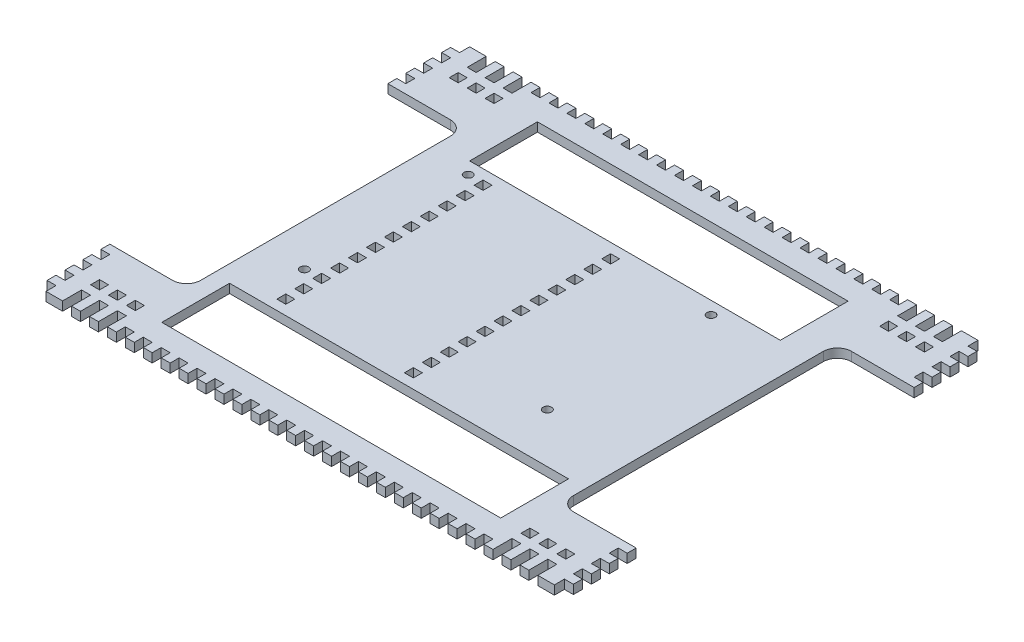
from build123d import *

# Parameters (mm, degrees)
SKETCH1_W                                  = 180
SKETCH1_H                                  = 150
BOSS_EXTRUDE1_DEPTH                        = 3.175
SKETCH3_R                                  = 1.375
CUT_EXTRUDE1_DEPTH                         = 10
SKETCH4_W                                  = 6.35
SKETCH4_H                                  = 3.175
BOSS_EXTRUDE2_DEPTH                        = 3.175
LPATTERN1_COUNT                            = 12
LPATTERN1_PITCH                            = 6.35
LPATTERN1_COL_COUNT                        = 12
LPATTERN1_COL_PITCH                        = 6.35
MIRROR1_COPY_1_SKETCH_W                    = 6.35
MIRROR1_COPY_1_SKETCH_H                    = 3.175
MIRROR1_COPY_1_DEPTH                       = 3.175
MIRROR1_COPY_2_SKETCH_W                    = 6.35
MIRROR1_COPY_2_SKETCH_H                    = 3.175
MIRROR1_COPY_2_DEPTH                       = 3.175
MIRROR1_COPY_3_SKETCH_W                    = 6.35
MIRROR1_COPY_3_SKETCH_H                    = 3.175
MIRROR1_COPY_3_DEPTH                       = 3.175
MIRROR1_COPY_4_SKETCH_W                    = 6.35
MIRROR1_COPY_4_SKETCH_H                    = 3.175
MIRROR1_COPY_4_DEPTH                       = 3.175
MIRROR1_COPY_5_SKETCH_W                    = 6.35
MIRROR1_COPY_5_SKETCH_H                    = 3.175
MIRROR1_COPY_5_DEPTH                       = 3.175
MIRROR1_COPY_6_SKETCH_W                    = 6.35
MIRROR1_COPY_6_SKETCH_H                    = 3.175
MIRROR1_COPY_6_DEPTH                       = 3.175
MIRROR1_COPY_7_SKETCH_W                    = 6.35
MIRROR1_COPY_7_SKETCH_H                    = 3.175
MIRROR1_COPY_7_DEPTH                       = 3.175
MIRROR1_COPY_8_SKETCH_W                    = 6.35
MIRROR1_COPY_8_SKETCH_H                    = 3.175
MIRROR1_COPY_8_DEPTH                       = 3.175
MIRROR1_COPY_9_SKETCH_W                    = 6.35
MIRROR1_COPY_9_SKETCH_H                    = 3.175
MIRROR1_COPY_9_DEPTH                       = 3.175
MIRROR1_COPY_10_SKETCH_W                   = 6.35
MIRROR1_COPY_10_SKETCH_H                   = 3.175
MIRROR1_COPY_10_DEPTH                      = 3.175
MIRROR1_COPY_11_SKETCH_W                   = 6.35
MIRROR1_COPY_11_SKETCH_H                   = 3.175
MIRROR1_COPY_11_DEPTH                      = 3.175
MIRROR1_COPY_12_SKETCH_W                   = 6.35
MIRROR1_COPY_12_SKETCH_H                   = 3.175
MIRROR1_COPY_12_DEPTH                      = 3.175
MIRROR1_COPY_13_SKETCH_W                   = 6.35
MIRROR1_COPY_13_SKETCH_H                   = 3.175
MIRROR1_COPY_13_DEPTH                      = 3.175
MIRROR1_COPY_14_SKETCH_W                   = 6.35
MIRROR1_COPY_14_SKETCH_H                   = 3.175
MIRROR1_COPY_14_DEPTH                      = 3.175
MIRROR1_COPY_15_SKETCH_W                   = 6.35
MIRROR1_COPY_15_SKETCH_H                   = 3.175
MIRROR1_COPY_15_DEPTH                      = 3.175
MIRROR1_COPY_16_SKETCH_W                   = 6.35
MIRROR1_COPY_16_SKETCH_H                   = 3.175
MIRROR1_COPY_16_DEPTH                      = 3.175
MIRROR1_COPY_17_SKETCH_W                   = 6.35
MIRROR1_COPY_17_SKETCH_H                   = 3.175
MIRROR1_COPY_17_DEPTH                      = 3.175
MIRROR1_COPY_18_SKETCH_W                   = 6.35
MIRROR1_COPY_18_SKETCH_H                   = 3.175
MIRROR1_COPY_18_DEPTH                      = 3.175
MIRROR1_COPY_19_SKETCH_W                   = 6.35
MIRROR1_COPY_19_SKETCH_H                   = 3.175
MIRROR1_COPY_19_DEPTH                      = 3.175
MIRROR1_COPY_20_SKETCH_W                   = 6.35
MIRROR1_COPY_20_SKETCH_H                   = 3.175
MIRROR1_COPY_20_DEPTH                      = 3.175
MIRROR1_COPY_21_SKETCH_W                   = 6.35
MIRROR1_COPY_21_SKETCH_H                   = 3.175
MIRROR1_COPY_21_DEPTH                      = 3.175
MIRROR1_COPY_22_SKETCH_W                   = 6.35
MIRROR1_COPY_22_SKETCH_H                   = 3.175
MIRROR1_COPY_22_DEPTH                      = 3.175
SKETCH6_W                                  = 3.175
SKETCH6_H                                  = 3.175
CUT_EXTRUDE3_DEPTH                         = 10
LPATTERN2_COUNT                            = 14
LPATTERN2_PITCH                            = 6.35
LPATTERN2_COL_COUNT                        = 14
LPATTERN2_COL_PITCH                        = 6.35
MIRROR2_COPY_1_SKETCH_W                    = 3.175
MIRROR2_COPY_1_SKETCH_H                    = 3.175
MIRROR2_COPY_1_DEPTH                       = 10
MIRROR2_COPY_2_SKETCH_W                    = 3.175
MIRROR2_COPY_2_SKETCH_H                    = 3.175
MIRROR2_COPY_2_DEPTH                       = 10
MIRROR2_COPY_3_SKETCH_W                    = 3.175
MIRROR2_COPY_3_SKETCH_H                    = 3.175
MIRROR2_COPY_3_DEPTH                       = 10
MIRROR2_COPY_4_SKETCH_W                    = 3.175
MIRROR2_COPY_4_SKETCH_H                    = 3.175
MIRROR2_COPY_4_DEPTH                       = 10
MIRROR2_COPY_5_SKETCH_W                    = 3.175
MIRROR2_COPY_5_SKETCH_H                    = 3.175
MIRROR2_COPY_5_DEPTH                       = 10
MIRROR2_COPY_6_SKETCH_W                    = 3.175
MIRROR2_COPY_6_SKETCH_H                    = 3.175
MIRROR2_COPY_6_DEPTH                       = 10
MIRROR2_COPY_7_SKETCH_W                    = 3.175
MIRROR2_COPY_7_SKETCH_H                    = 3.175
MIRROR2_COPY_7_DEPTH                       = 10
MIRROR2_COPY_8_SKETCH_W                    = 3.175
MIRROR2_COPY_8_SKETCH_H                    = 3.175
MIRROR2_COPY_8_DEPTH                       = 10
MIRROR2_COPY_9_SKETCH_W                    = 3.175
MIRROR2_COPY_9_SKETCH_H                    = 3.175
MIRROR2_COPY_9_DEPTH                       = 10
MIRROR2_COPY_10_SKETCH_W                   = 3.175
MIRROR2_COPY_10_SKETCH_H                   = 3.175
MIRROR2_COPY_10_DEPTH                      = 10
MIRROR2_COPY_11_SKETCH_W                   = 3.175
MIRROR2_COPY_11_SKETCH_H                   = 3.175
MIRROR2_COPY_11_DEPTH                      = 10
MIRROR2_COPY_12_SKETCH_W                   = 3.175
MIRROR2_COPY_12_SKETCH_H                   = 3.175
MIRROR2_COPY_12_DEPTH                      = 10
MIRROR2_COPY_13_SKETCH_W                   = 3.175
MIRROR2_COPY_13_SKETCH_H                   = 3.175
MIRROR2_COPY_13_DEPTH                      = 10
MIRROR2_COPY_14_SKETCH_W                   = 3.175
MIRROR2_COPY_14_SKETCH_H                   = 3.175
MIRROR2_COPY_14_DEPTH                      = 10
MIRROR2_COPY_15_SKETCH_W                   = 3.175
MIRROR2_COPY_15_SKETCH_H                   = 3.175
MIRROR2_COPY_15_DEPTH                      = 10
MIRROR2_COPY_16_SKETCH_W                   = 3.175
MIRROR2_COPY_16_SKETCH_H                   = 3.175
MIRROR2_COPY_16_DEPTH                      = 10
MIRROR2_COPY_17_SKETCH_W                   = 3.175
MIRROR2_COPY_17_SKETCH_H                   = 3.175
MIRROR2_COPY_17_DEPTH                      = 10
MIRROR2_COPY_18_SKETCH_W                   = 3.175
MIRROR2_COPY_18_SKETCH_H                   = 3.175
MIRROR2_COPY_18_DEPTH                      = 10
MIRROR2_COPY_19_SKETCH_W                   = 3.175
MIRROR2_COPY_19_SKETCH_H                   = 3.175
MIRROR2_COPY_19_DEPTH                      = 10
MIRROR2_COPY_20_SKETCH_W                   = 3.175
MIRROR2_COPY_20_SKETCH_H                   = 3.175
MIRROR2_COPY_20_DEPTH                      = 10
MIRROR2_COPY_21_SKETCH_W                   = 3.175
MIRROR2_COPY_21_SKETCH_H                   = 3.175
MIRROR2_COPY_21_DEPTH                      = 10
MIRROR2_COPY_22_SKETCH_W                   = 3.175
MIRROR2_COPY_22_SKETCH_H                   = 3.175
MIRROR2_COPY_22_DEPTH                      = 10
MIRROR2_COPY_23_SKETCH_W                   = 3.175
MIRROR2_COPY_23_SKETCH_H                   = 3.175
MIRROR2_COPY_23_DEPTH                      = 10
MIRROR2_COPY_24_SKETCH_W                   = 3.175
MIRROR2_COPY_24_SKETCH_H                   = 3.175
MIRROR2_COPY_24_DEPTH                      = 10
MIRROR2_COPY_25_SKETCH_W                   = 3.175
MIRROR2_COPY_25_SKETCH_H                   = 3.175
MIRROR2_COPY_25_DEPTH                      = 10
MIRROR2_COPY_26_SKETCH_W                   = 3.175
MIRROR2_COPY_26_SKETCH_H                   = 3.175
MIRROR2_COPY_26_DEPTH                      = 10
SKETCH12_W                                 = 55
SKETCH12_H                                 = 24
SKETCH12_W_2                               = 60
CUT_EXTRUDE7_DEPTH                         = 10
SKETCH13_W                                 = 3.175
SKETCH13_H                                 = 3.175
CUT_EXTRUDE8_DEPTH                         = 10
LPATTERN3_COUNT                            = 7
LPATTERN3_PITCH                            = 6.35
LPATTERN3_COUNT_DIR2                       = 7
LPATTERN3_PITCH_DIR2                       = 6.35
SKETCH15_R                                 = 1.5
CUT_EXTRUDE10_DEPTH                        = 10
SKETCH17_W                                 = 3.175
SKETCH17_H                                 = 3.175
CUT_EXTRUDE12_DEPTH                        = 10
MIRROR5_COPY_1_SKETCH_W                    = 3.175
MIRROR5_COPY_1_SKETCH_H                    = 3.175
MIRROR5_COPY_1_DEPTH                       = 10
SKETCH18_W                                 = 3.175
SKETCH18_H                                 = 3.175
CUT_EXTRUDE13_DEPTH                        = 10
LPATTERN4_COUNT                            = 7
LPATTERN4_PITCH                            = 6.35
LPATTERN4_COUNT_DIR2                       = 7
LPATTERN4_PITCH_DIR2                       = 6.35
SKETCH21_W                                 = 34
SKETCH21_H                                 = 98.425
CUT_EXTRUDE15_DEPTH                        = 10
SKETCH22_W                                 = 3.175
SKETCH22_H                                 = 3.175
CUT_EXTRUDE16_DEPTH                        = 10
MIRROR8_COPY_1_SKETCH_W                    = 3.175
MIRROR8_COPY_1_SKETCH_H                    = 3.175
MIRROR8_COPY_1_DEPTH                       = 10
FILLET1_R                                  = 5
SKETCH24_W                                 = 3.175
SKETCH24_H                                 = 0.3875
CUT_EXTRUDE17_DEPTH                        = 10
MIRROR10_AT_THE_SECOND_PLANE_COPY_1_SKET_W = 3.175
MIRROR10_AT_THE_SECOND_PLANE_COPY_1_SKET_H = 0.3875
MIRROR10_AT_THE_SECOND_PLANE_COPY_1_DEPTH  = 10


with BuildPart() as part:
    # Sketch1 → Boss-Extrude1 (new body)
    with BuildSketch(Plane(origin=(0, 0, 0), x_dir=(1, 0, 0), z_dir=(0, 1, 0))):
        Rectangle(SKETCH1_W, SKETCH1_H)
    extrude(amount=BOSS_EXTRUDE1_DEPTH)

    # Sketch3 → Cut-Extrude1 (cut)
    with BuildSketch(Plane(origin=(0, 3.175, 0), x_dir=(1, 0, 0), z_dir=(0, 1, 0))):
        with Locations(Location((-51, 35.5, 0), (0, 0, 270))):
            Circle(SKETCH3_R)
        with Locations(Location((-51, -22.5, 0), (0, 0, 270))):
            Circle(SKETCH3_R)
        with Locations(Location((35, 35.5, 0), (0, 0, 270))):
            Circle(SKETCH3_R)
        with Locations(Location((35, -22.5, 0), (0, 0, 270))):
            Circle(SKETCH3_R)
    extrude(amount=-CUT_EXTRUDE1_DEPTH, mode=Mode.SUBTRACT)

    # Sketch4 → Boss-Extrude2 (add)
    with BuildSketch(Plane(origin=(0, 3.175, 0), x_dir=(1, 0, 0), z_dir=(0, 1, 0))):
        with Locations((-90, 0)):
            Rectangle(SKETCH4_W, SKETCH4_H)
    boss_extrude2 = extrude(amount=-BOSS_EXTRUDE2_DEPTH)

    # LPattern1: Boss-Extrude2 ×12
    with Locations(*[(0, 0, i * LPATTERN1_PITCH) for i in range(1, LPATTERN1_COUNT)]):
        add(boss_extrude2)

    # LPattern1 col: Boss-Extrude2 ×12
    with Locations(*[(0, 0, -i * LPATTERN1_COL_PITCH) for i in range(1, LPATTERN1_COL_COUNT)]):
        add(boss_extrude2)

    # Mirror1: Boss-Extrude2 across plane
    add(boss_extrude2.mirror(Plane(origin=(0, 0, 0), x_dir=(0, 0, 1), z_dir=(1, 0, 0))))

    # Mirror1 copy 1 sketch → Mirror1 copy 1 (add)
    with BuildSketch(Plane(origin=(0, 3.175, 6.35), x_dir=(-1, 0, 0), z_dir=(0, 1, 0))):
        with Locations((-90, 0)):
            Rectangle(MIRROR1_COPY_1_SKETCH_W, MIRROR1_COPY_1_SKETCH_H)
    extrude(amount=-MIRROR1_COPY_1_DEPTH)

    # Mirror1 copy 2 sketch → Mirror1 copy 2 (add)
    with BuildSketch(Plane(origin=(0, 3.175, 12.7), x_dir=(-1, 0, 0), z_dir=(0, 1, 0))):
        with Locations((-90, 0)):
            Rectangle(MIRROR1_COPY_2_SKETCH_W, MIRROR1_COPY_2_SKETCH_H)
    extrude(amount=-MIRROR1_COPY_2_DEPTH)

    # Mirror1 copy 3 sketch → Mirror1 copy 3 (add)
    with BuildSketch(Plane(origin=(0, 3.175, 19.05), x_dir=(-1, 0, 0), z_dir=(0, 1, 0))):
        with Locations((-90, 0)):
            Rectangle(MIRROR1_COPY_3_SKETCH_W, MIRROR1_COPY_3_SKETCH_H)
    extrude(amount=-MIRROR1_COPY_3_DEPTH)

    # Mirror1 copy 4 sketch → Mirror1 copy 4 (add)
    with BuildSketch(Plane(origin=(0, 3.175, 25.4), x_dir=(-1, 0, 0), z_dir=(0, 1, 0))):
        with Locations((-90, 0)):
            Rectangle(MIRROR1_COPY_4_SKETCH_W, MIRROR1_COPY_4_SKETCH_H)
    extrude(amount=-MIRROR1_COPY_4_DEPTH)

    # Mirror1 copy 5 sketch → Mirror1 copy 5 (add)
    with BuildSketch(Plane(origin=(0, 3.175, 31.75), x_dir=(-1, 0, 0), z_dir=(0, 1, 0))):
        with Locations((-90, 0)):
            Rectangle(MIRROR1_COPY_5_SKETCH_W, MIRROR1_COPY_5_SKETCH_H)
    extrude(amount=-MIRROR1_COPY_5_DEPTH)

    # Mirror1 copy 6 sketch → Mirror1 copy 6 (add)
    with BuildSketch(Plane(origin=(0, 3.175, 38.1), x_dir=(-1, 0, 0), z_dir=(0, 1, 0))):
        with Locations((-90, 0)):
            Rectangle(MIRROR1_COPY_6_SKETCH_W, MIRROR1_COPY_6_SKETCH_H)
    extrude(amount=-MIRROR1_COPY_6_DEPTH)

    # Mirror1 copy 7 sketch → Mirror1 copy 7 (add)
    with BuildSketch(Plane(origin=(0, 3.175, 44.45), x_dir=(-1, 0, 0), z_dir=(0, 1, 0))):
        with Locations((-90, 0)):
            Rectangle(MIRROR1_COPY_7_SKETCH_W, MIRROR1_COPY_7_SKETCH_H)
    extrude(amount=-MIRROR1_COPY_7_DEPTH)

    # Mirror1 copy 8 sketch → Mirror1 copy 8 (add)
    with BuildSketch(Plane(origin=(0, 3.175, 50.8), x_dir=(-1, 0, 0), z_dir=(0, 1, 0))):
        with Locations((-90, 0)):
            Rectangle(MIRROR1_COPY_8_SKETCH_W, MIRROR1_COPY_8_SKETCH_H)
    extrude(amount=-MIRROR1_COPY_8_DEPTH)

    # Mirror1 copy 9 sketch → Mirror1 copy 9 (add)
    with BuildSketch(Plane(origin=(0, 3.175, 57.15), x_dir=(-1, 0, 0), z_dir=(0, 1, 0))):
        with Locations((-90, 0)):
            Rectangle(MIRROR1_COPY_9_SKETCH_W, MIRROR1_COPY_9_SKETCH_H)
    extrude(amount=-MIRROR1_COPY_9_DEPTH)

    # Mirror1 copy 10 sketch → Mirror1 copy 10 (add)
    with BuildSketch(Plane(origin=(0, 3.175, 63.5), x_dir=(-1, 0, 0), z_dir=(0, 1, 0))):
        with Locations((-90, 0)):
            Rectangle(MIRROR1_COPY_10_SKETCH_W, MIRROR1_COPY_10_SKETCH_H)
    extrude(amount=-MIRROR1_COPY_10_DEPTH)

    # Mirror1 copy 11 sketch → Mirror1 copy 11 (add)
    with BuildSketch(Plane(origin=(0, 3.175, 69.85), x_dir=(-1, 0, 0), z_dir=(0, 1, 0))):
        with Locations((-90, 0)):
            Rectangle(MIRROR1_COPY_11_SKETCH_W, MIRROR1_COPY_11_SKETCH_H)
    extrude(amount=-MIRROR1_COPY_11_DEPTH)

    # Mirror1 copy 12 sketch → Mirror1 copy 12 (add)
    with BuildSketch(Plane(origin=(0, 3.175, -6.35), x_dir=(-1, 0, 0), z_dir=(0, 1, 0))):
        with Locations((-90, 0)):
            Rectangle(MIRROR1_COPY_12_SKETCH_W, MIRROR1_COPY_12_SKETCH_H)
    extrude(amount=-MIRROR1_COPY_12_DEPTH)

    # Mirror1 copy 13 sketch → Mirror1 copy 13 (add)
    with BuildSketch(Plane(origin=(0, 3.175, -12.7), x_dir=(-1, 0, 0), z_dir=(0, 1, 0))):
        with Locations((-90, 0)):
            Rectangle(MIRROR1_COPY_13_SKETCH_W, MIRROR1_COPY_13_SKETCH_H)
    extrude(amount=-MIRROR1_COPY_13_DEPTH)

    # Mirror1 copy 14 sketch → Mirror1 copy 14 (add)
    with BuildSketch(Plane(origin=(0, 3.175, -19.05), x_dir=(-1, 0, 0), z_dir=(0, 1, 0))):
        with Locations((-90, 0)):
            Rectangle(MIRROR1_COPY_14_SKETCH_W, MIRROR1_COPY_14_SKETCH_H)
    extrude(amount=-MIRROR1_COPY_14_DEPTH)

    # Mirror1 copy 15 sketch → Mirror1 copy 15 (add)
    with BuildSketch(Plane(origin=(0, 3.175, -25.4), x_dir=(-1, 0, 0), z_dir=(0, 1, 0))):
        with Locations((-90, 0)):
            Rectangle(MIRROR1_COPY_15_SKETCH_W, MIRROR1_COPY_15_SKETCH_H)
    extrude(amount=-MIRROR1_COPY_15_DEPTH)

    # Mirror1 copy 16 sketch → Mirror1 copy 16 (add)
    with BuildSketch(Plane(origin=(0, 3.175, -31.75), x_dir=(-1, 0, 0), z_dir=(0, 1, 0))):
        with Locations((-90, 0)):
            Rectangle(MIRROR1_COPY_16_SKETCH_W, MIRROR1_COPY_16_SKETCH_H)
    extrude(amount=-MIRROR1_COPY_16_DEPTH)

    # Mirror1 copy 17 sketch → Mirror1 copy 17 (add)
    with BuildSketch(Plane(origin=(0, 3.175, -38.1), x_dir=(-1, 0, 0), z_dir=(0, 1, 0))):
        with Locations((-90, 0)):
            Rectangle(MIRROR1_COPY_17_SKETCH_W, MIRROR1_COPY_17_SKETCH_H)
    extrude(amount=-MIRROR1_COPY_17_DEPTH)

    # Mirror1 copy 18 sketch → Mirror1 copy 18 (add)
    with BuildSketch(Plane(origin=(0, 3.175, -44.45), x_dir=(-1, 0, 0), z_dir=(0, 1, 0))):
        with Locations((-90, 0)):
            Rectangle(MIRROR1_COPY_18_SKETCH_W, MIRROR1_COPY_18_SKETCH_H)
    extrude(amount=-MIRROR1_COPY_18_DEPTH)

    # Mirror1 copy 19 sketch → Mirror1 copy 19 (add)
    with BuildSketch(Plane(origin=(0, 3.175, -50.8), x_dir=(-1, 0, 0), z_dir=(0, 1, 0))):
        with Locations((-90, 0)):
            Rectangle(MIRROR1_COPY_19_SKETCH_W, MIRROR1_COPY_19_SKETCH_H)
    extrude(amount=-MIRROR1_COPY_19_DEPTH)

    # Mirror1 copy 20 sketch → Mirror1 copy 20 (add)
    with BuildSketch(Plane(origin=(0, 3.175, -57.15), x_dir=(-1, 0, 0), z_dir=(0, 1, 0))):
        with Locations((-90, 0)):
            Rectangle(MIRROR1_COPY_20_SKETCH_W, MIRROR1_COPY_20_SKETCH_H)
    extrude(amount=-MIRROR1_COPY_20_DEPTH)

    # Mirror1 copy 21 sketch → Mirror1 copy 21 (add)
    with BuildSketch(Plane(origin=(0, 3.175, -63.5), x_dir=(-1, 0, 0), z_dir=(0, 1, 0))):
        with Locations((-90, 0)):
            Rectangle(MIRROR1_COPY_21_SKETCH_W, MIRROR1_COPY_21_SKETCH_H)
    extrude(amount=-MIRROR1_COPY_21_DEPTH)

    # Mirror1 copy 22 sketch → Mirror1 copy 22 (add)
    with BuildSketch(Plane(origin=(0, 3.175, -69.85), x_dir=(-1, 0, 0), z_dir=(0, 1, 0))):
        with Locations((-90, 0)):
            Rectangle(MIRROR1_COPY_22_SKETCH_W, MIRROR1_COPY_22_SKETCH_H)
    extrude(amount=-MIRROR1_COPY_22_DEPTH)

    # Sketch6 → Cut-Extrude3 (cut)
    with BuildSketch(Plane(origin=(0, 3.175, 0), x_dir=(1, 0, 0), z_dir=(0, 1, 0))):
        with Locations((0, -73.4125)):
            Rectangle(SKETCH6_W, SKETCH6_H)
    cut_extrude3 = extrude(amount=-CUT_EXTRUDE3_DEPTH, mode=Mode.SUBTRACT)

    # LPattern2: Cut-Extrude3 ×14
    with Locations(*[(i * LPATTERN2_PITCH, 0, 0) for i in range(1, LPATTERN2_COUNT)]):
        add(cut_extrude3, mode=Mode.SUBTRACT)

    # LPattern2 col: Cut-Extrude3 ×14
    with Locations(*[(-i * LPATTERN2_COL_PITCH, 0, 0) for i in range(1, LPATTERN2_COL_COUNT)]):
        add(cut_extrude3, mode=Mode.SUBTRACT)

    # Mirror2: Cut-Extrude3 across plane
    add(cut_extrude3.mirror(Plane.XY), mode=Mode.SUBTRACT)

    # Mirror2 copy 1 sketch → Mirror2 copy 1 (cut)
    with BuildSketch(Plane(origin=(6.35, 3.175, 0), x_dir=(1, 0, 0), z_dir=(0, 1, 0))):
        with Locations((0, 73.4125)):
            Rectangle(MIRROR2_COPY_1_SKETCH_W, MIRROR2_COPY_1_SKETCH_H)
    extrude(amount=-MIRROR2_COPY_1_DEPTH, mode=Mode.SUBTRACT)

    # Mirror2 copy 2 sketch → Mirror2 copy 2 (cut)
    with BuildSketch(Plane(origin=(12.7, 3.175, 0), x_dir=(1, 0, 0), z_dir=(0, 1, 0))):
        with Locations((0, 73.4125)):
            Rectangle(MIRROR2_COPY_2_SKETCH_W, MIRROR2_COPY_2_SKETCH_H)
    extrude(amount=-MIRROR2_COPY_2_DEPTH, mode=Mode.SUBTRACT)

    # Mirror2 copy 3 sketch → Mirror2 copy 3 (cut)
    with BuildSketch(Plane(origin=(19.05, 3.175, 0), x_dir=(1, 0, 0), z_dir=(0, 1, 0))):
        with Locations((0, 73.4125)):
            Rectangle(MIRROR2_COPY_3_SKETCH_W, MIRROR2_COPY_3_SKETCH_H)
    extrude(amount=-MIRROR2_COPY_3_DEPTH, mode=Mode.SUBTRACT)

    # Mirror2 copy 4 sketch → Mirror2 copy 4 (cut)
    with BuildSketch(Plane(origin=(25.4, 3.175, 0), x_dir=(1, 0, 0), z_dir=(0, 1, 0))):
        with Locations((0, 73.4125)):
            Rectangle(MIRROR2_COPY_4_SKETCH_W, MIRROR2_COPY_4_SKETCH_H)
    extrude(amount=-MIRROR2_COPY_4_DEPTH, mode=Mode.SUBTRACT)

    # Mirror2 copy 5 sketch → Mirror2 copy 5 (cut)
    with BuildSketch(Plane(origin=(31.75, 3.175, 0), x_dir=(1, 0, 0), z_dir=(0, 1, 0))):
        with Locations((0, 73.4125)):
            Rectangle(MIRROR2_COPY_5_SKETCH_W, MIRROR2_COPY_5_SKETCH_H)
    extrude(amount=-MIRROR2_COPY_5_DEPTH, mode=Mode.SUBTRACT)

    # Mirror2 copy 6 sketch → Mirror2 copy 6 (cut)
    with BuildSketch(Plane(origin=(38.1, 3.175, 0), x_dir=(1, 0, 0), z_dir=(0, 1, 0))):
        with Locations((0, 73.4125)):
            Rectangle(MIRROR2_COPY_6_SKETCH_W, MIRROR2_COPY_6_SKETCH_H)
    extrude(amount=-MIRROR2_COPY_6_DEPTH, mode=Mode.SUBTRACT)

    # Mirror2 copy 7 sketch → Mirror2 copy 7 (cut)
    with BuildSketch(Plane(origin=(44.45, 3.175, 0), x_dir=(1, 0, 0), z_dir=(0, 1, 0))):
        with Locations((0, 73.4125)):
            Rectangle(MIRROR2_COPY_7_SKETCH_W, MIRROR2_COPY_7_SKETCH_H)
    extrude(amount=-MIRROR2_COPY_7_DEPTH, mode=Mode.SUBTRACT)

    # Mirror2 copy 8 sketch → Mirror2 copy 8 (cut)
    with BuildSketch(Plane(origin=(50.8, 3.175, 0), x_dir=(1, 0, 0), z_dir=(0, 1, 0))):
        with Locations((0, 73.4125)):
            Rectangle(MIRROR2_COPY_8_SKETCH_W, MIRROR2_COPY_8_SKETCH_H)
    extrude(amount=-MIRROR2_COPY_8_DEPTH, mode=Mode.SUBTRACT)

    # Mirror2 copy 9 sketch → Mirror2 copy 9 (cut)
    with BuildSketch(Plane(origin=(57.15, 3.175, 0), x_dir=(1, 0, 0), z_dir=(0, 1, 0))):
        with Locations((0, 73.4125)):
            Rectangle(MIRROR2_COPY_9_SKETCH_W, MIRROR2_COPY_9_SKETCH_H)
    extrude(amount=-MIRROR2_COPY_9_DEPTH, mode=Mode.SUBTRACT)

    # Mirror2 copy 10 sketch → Mirror2 copy 10 (cut)
    with BuildSketch(Plane(origin=(63.5, 3.175, 0), x_dir=(1, 0, 0), z_dir=(0, 1, 0))):
        with Locations((0, 73.4125)):
            Rectangle(MIRROR2_COPY_10_SKETCH_W, MIRROR2_COPY_10_SKETCH_H)
    extrude(amount=-MIRROR2_COPY_10_DEPTH, mode=Mode.SUBTRACT)

    # Mirror2 copy 11 sketch → Mirror2 copy 11 (cut)
    with BuildSketch(Plane(origin=(69.85, 3.175, 0), x_dir=(1, 0, 0), z_dir=(0, 1, 0))):
        with Locations((0, 73.4125)):
            Rectangle(MIRROR2_COPY_11_SKETCH_W, MIRROR2_COPY_11_SKETCH_H)
    extrude(amount=-MIRROR2_COPY_11_DEPTH, mode=Mode.SUBTRACT)

    # Mirror2 copy 12 sketch → Mirror2 copy 12 (cut)
    with BuildSketch(Plane(origin=(76.2, 3.175, 0), x_dir=(1, 0, 0), z_dir=(0, 1, 0))):
        with Locations((0, 73.4125)):
            Rectangle(MIRROR2_COPY_12_SKETCH_W, MIRROR2_COPY_12_SKETCH_H)
    extrude(amount=-MIRROR2_COPY_12_DEPTH, mode=Mode.SUBTRACT)

    # Mirror2 copy 13 sketch → Mirror2 copy 13 (cut)
    with BuildSketch(Plane(origin=(82.55, 3.175, 0), x_dir=(1, 0, 0), z_dir=(0, 1, 0))):
        with Locations((0, 73.4125)):
            Rectangle(MIRROR2_COPY_13_SKETCH_W, MIRROR2_COPY_13_SKETCH_H)
    extrude(amount=-MIRROR2_COPY_13_DEPTH, mode=Mode.SUBTRACT)

    # Mirror2 copy 14 sketch → Mirror2 copy 14 (cut)
    with BuildSketch(Plane(origin=(-6.35, 3.175, 0), x_dir=(1, 0, 0), z_dir=(0, 1, 0))):
        with Locations((0, 73.4125)):
            Rectangle(MIRROR2_COPY_14_SKETCH_W, MIRROR2_COPY_14_SKETCH_H)
    extrude(amount=-MIRROR2_COPY_14_DEPTH, mode=Mode.SUBTRACT)

    # Mirror2 copy 15 sketch → Mirror2 copy 15 (cut)
    with BuildSketch(Plane(origin=(-12.7, 3.175, 0), x_dir=(1, 0, 0), z_dir=(0, 1, 0))):
        with Locations((0, 73.4125)):
            Rectangle(MIRROR2_COPY_15_SKETCH_W, MIRROR2_COPY_15_SKETCH_H)
    extrude(amount=-MIRROR2_COPY_15_DEPTH, mode=Mode.SUBTRACT)

    # Mirror2 copy 16 sketch → Mirror2 copy 16 (cut)
    with BuildSketch(Plane(origin=(-19.05, 3.175, 0), x_dir=(1, 0, 0), z_dir=(0, 1, 0))):
        with Locations((0, 73.4125)):
            Rectangle(MIRROR2_COPY_16_SKETCH_W, MIRROR2_COPY_16_SKETCH_H)
    extrude(amount=-MIRROR2_COPY_16_DEPTH, mode=Mode.SUBTRACT)

    # Mirror2 copy 17 sketch → Mirror2 copy 17 (cut)
    with BuildSketch(Plane(origin=(-25.4, 3.175, 0), x_dir=(1, 0, 0), z_dir=(0, 1, 0))):
        with Locations((0, 73.4125)):
            Rectangle(MIRROR2_COPY_17_SKETCH_W, MIRROR2_COPY_17_SKETCH_H)
    extrude(amount=-MIRROR2_COPY_17_DEPTH, mode=Mode.SUBTRACT)

    # Mirror2 copy 18 sketch → Mirror2 copy 18 (cut)
    with BuildSketch(Plane(origin=(-31.75, 3.175, 0), x_dir=(1, 0, 0), z_dir=(0, 1, 0))):
        with Locations((0, 73.4125)):
            Rectangle(MIRROR2_COPY_18_SKETCH_W, MIRROR2_COPY_18_SKETCH_H)
    extrude(amount=-MIRROR2_COPY_18_DEPTH, mode=Mode.SUBTRACT)

    # Mirror2 copy 19 sketch → Mirror2 copy 19 (cut)
    with BuildSketch(Plane(origin=(-38.1, 3.175, 0), x_dir=(1, 0, 0), z_dir=(0, 1, 0))):
        with Locations((0, 73.4125)):
            Rectangle(MIRROR2_COPY_19_SKETCH_W, MIRROR2_COPY_19_SKETCH_H)
    extrude(amount=-MIRROR2_COPY_19_DEPTH, mode=Mode.SUBTRACT)

    # Mirror2 copy 20 sketch → Mirror2 copy 20 (cut)
    with BuildSketch(Plane(origin=(-44.45, 3.175, 0), x_dir=(1, 0, 0), z_dir=(0, 1, 0))):
        with Locations((0, 73.4125)):
            Rectangle(MIRROR2_COPY_20_SKETCH_W, MIRROR2_COPY_20_SKETCH_H)
    extrude(amount=-MIRROR2_COPY_20_DEPTH, mode=Mode.SUBTRACT)

    # Mirror2 copy 21 sketch → Mirror2 copy 21 (cut)
    with BuildSketch(Plane(origin=(-50.8, 3.175, 0), x_dir=(1, 0, 0), z_dir=(0, 1, 0))):
        with Locations((0, 73.4125)):
            Rectangle(MIRROR2_COPY_21_SKETCH_W, MIRROR2_COPY_21_SKETCH_H)
    extrude(amount=-MIRROR2_COPY_21_DEPTH, mode=Mode.SUBTRACT)

    # Mirror2 copy 22 sketch → Mirror2 copy 22 (cut)
    with BuildSketch(Plane(origin=(-57.15, 3.175, 0), x_dir=(1, 0, 0), z_dir=(0, 1, 0))):
        with Locations((0, 73.4125)):
            Rectangle(MIRROR2_COPY_22_SKETCH_W, MIRROR2_COPY_22_SKETCH_H)
    extrude(amount=-MIRROR2_COPY_22_DEPTH, mode=Mode.SUBTRACT)

    # Mirror2 copy 23 sketch → Mirror2 copy 23 (cut)
    with BuildSketch(Plane(origin=(-63.5, 3.175, 0), x_dir=(1, 0, 0), z_dir=(0, 1, 0))):
        with Locations((0, 73.4125)):
            Rectangle(MIRROR2_COPY_23_SKETCH_W, MIRROR2_COPY_23_SKETCH_H)
    extrude(amount=-MIRROR2_COPY_23_DEPTH, mode=Mode.SUBTRACT)

    # Mirror2 copy 24 sketch → Mirror2 copy 24 (cut)
    with BuildSketch(Plane(origin=(-69.85, 3.175, 0), x_dir=(1, 0, 0), z_dir=(0, 1, 0))):
        with Locations((0, 73.4125)):
            Rectangle(MIRROR2_COPY_24_SKETCH_W, MIRROR2_COPY_24_SKETCH_H)
    extrude(amount=-MIRROR2_COPY_24_DEPTH, mode=Mode.SUBTRACT)

    # Mirror2 copy 25 sketch → Mirror2 copy 25 (cut)
    with BuildSketch(Plane(origin=(-76.2, 3.175, 0), x_dir=(1, 0, 0), z_dir=(0, 1, 0))):
        with Locations((0, 73.4125)):
            Rectangle(MIRROR2_COPY_25_SKETCH_W, MIRROR2_COPY_25_SKETCH_H)
    extrude(amount=-MIRROR2_COPY_25_DEPTH, mode=Mode.SUBTRACT)

    # Mirror2 copy 26 sketch → Mirror2 copy 26 (cut)
    with BuildSketch(Plane(origin=(-82.55, 3.175, 0), x_dir=(1, 0, 0), z_dir=(0, 1, 0))):
        with Locations((0, 73.4125)):
            Rectangle(MIRROR2_COPY_26_SKETCH_W, MIRROR2_COPY_26_SKETCH_H)
    extrude(amount=-MIRROR2_COPY_26_DEPTH, mode=Mode.SUBTRACT)

    # Sketch12 → Cut-Extrude7 (cut)
    with BuildSketch(Plane(origin=(0, 3.175, 0), x_dir=(1, 0, 0), z_dir=(0, 1, 0))):
        with Locations((27.5, 52)):
            Rectangle(SKETCH12_W, SKETCH12_H)
        with Locations((30, -52)):
            Rectangle(SKETCH12_W_2, SKETCH12_H)
    cut_extrude7 = extrude(amount=-CUT_EXTRUDE7_DEPTH, mode=Mode.SUBTRACT)

    # Sketch13 → Cut-Extrude8 (cut)
    with BuildSketch(Plane(origin=(0, 3.175, 0), x_dir=(1, 0, 0), z_dir=(0, 1, 0))):
        with Locations((0, 3.175)):
            Rectangle(SKETCH13_W, SKETCH13_H)
    cut_extrude8 = extrude(amount=-CUT_EXTRUDE8_DEPTH, mode=Mode.SUBTRACT)

    # LPattern3: Cut-Extrude8 7 × 7, 1 skipped
    with Locations(*[Vector(0, 0, 1) * (i * LPATTERN3_PITCH) + Vector(0, 0, -1) * (j * LPATTERN3_PITCH_DIR2) for i in range(LPATTERN3_COUNT) for j in range(LPATTERN3_COUNT_DIR2) if (i, j) not in ((0, 0), (0, 6))]):
        add(cut_extrude8, mode=Mode.SUBTRACT)

    # Sketch15 → Cut-Extrude10 (cut)
    with BuildSketch(Plane(origin=(0, 3.175, 0), x_dir=(1, 0, 0), z_dir=(0, 1, 0))):
        with Locations(Location((-51, 35.5, 0), (0, 0, 270))):
            Circle(SKETCH15_R)
        with Locations(Location((35, 35.5, 0), (0, 0, 270))):
            Circle(SKETCH15_R)
        with Locations(Location((35, -22.5, 0), (0, 0, 270))):
            Circle(SKETCH15_R)
        with Locations(Location((-51, -22.5, 0), (0, 0, 270))):
            Circle(SKETCH15_R)
    extrude(amount=-CUT_EXTRUDE10_DEPTH, mode=Mode.SUBTRACT)

    # Sketch17 → Cut-Extrude12 (cut)
    with BuildSketch(Plane(origin=(0, 3.175, 0), x_dir=(1, 0, 0), z_dir=(0, 1, 0))):
        with Locations((-69.85, 70.2375)):
            Rectangle(SKETCH17_W, SKETCH17_H)
        with Locations((-76.2, 70.2375)):
            Rectangle(SKETCH17_W, SKETCH17_H)
        with Locations((-82.55, 70.2375)):
            Rectangle(SKETCH17_W, SKETCH17_H)
    cut_extrude12 = extrude(amount=-CUT_EXTRUDE12_DEPTH, mode=Mode.SUBTRACT)

    # Mirror4: Cut-Extrude12 across plane
    add(cut_extrude12.mirror(Plane.XY), mode=Mode.SUBTRACT)

    # Mirror5: Cut-Extrude12 across plane
    add(cut_extrude12.mirror(Plane(origin=(0, 0, 0), x_dir=(0, 0, 1), z_dir=(1, 0, 0))), mode=Mode.SUBTRACT)

    # Mirror5 copy 1 sketch → Mirror5 copy 1 (cut)
    with BuildSketch(Plane(origin=(0, 3.175, 0), x_dir=(-1, 0, 0), z_dir=(0, 1, 0))):
        with Locations((-69.85, 70.2375)):
            Rectangle(MIRROR5_COPY_1_SKETCH_W, MIRROR5_COPY_1_SKETCH_H)
        with Locations((-76.2, 70.2375)):
            Rectangle(MIRROR5_COPY_1_SKETCH_W, MIRROR5_COPY_1_SKETCH_H)
        with Locations((-82.55, 70.2375)):
            Rectangle(MIRROR5_COPY_1_SKETCH_W, MIRROR5_COPY_1_SKETCH_H)
    extrude(amount=-MIRROR5_COPY_1_DEPTH, mode=Mode.SUBTRACT)

    # Mirror6: Cut-Extrude7 across plane
    add(cut_extrude7.mirror(Plane(origin=(0, 0, 0), x_dir=(0, 0, 1), z_dir=(1, 0, 0))), mode=Mode.SUBTRACT)

    # Sketch18 → Cut-Extrude13 (cut)
    with BuildSketch(Plane(origin=(0, 3.175, 0), x_dir=(1, 0, 0), z_dir=(0, 1, 0))):
        with Locations((-45.175, 3.175)):
            Rectangle(SKETCH18_W, SKETCH18_H)
    cut_extrude13 = extrude(amount=-CUT_EXTRUDE13_DEPTH, mode=Mode.SUBTRACT)

    # LPattern4: Cut-Extrude13 7 × 7, 1 skipped
    with Locations(*[Vector(0, 0, 1) * (i * LPATTERN4_PITCH) + Vector(0, 0, -1) * (j * LPATTERN4_PITCH_DIR2) for i in range(LPATTERN4_COUNT) for j in range(LPATTERN4_COUNT_DIR2) if (i, j) not in ((0, 0), (0, 6))]):
        add(cut_extrude13, mode=Mode.SUBTRACT)

    # Sketch21 → Cut-Extrude15 (cut)
    with BuildSketch(Plane(origin=(0, 3.175, 0), x_dir=(1, 0, 0), z_dir=(0, 1, 0))):
        with Locations((83, 0)):
            Rectangle(SKETCH21_W, SKETCH21_H)
    cut_extrude15 = extrude(amount=-CUT_EXTRUDE15_DEPTH, mode=Mode.SUBTRACT)

    # Sketch22 → Cut-Extrude16 (cut)
    with BuildSketch(Plane(origin=(0, 3.175, 0), x_dir=(1, 0, 0), z_dir=(0, 1, 0))):
        with Locations((-82.55, 63.5)):
            Rectangle(SKETCH22_W, SKETCH22_H)
        with Locations((-76.2, 63.5)):
            Rectangle(SKETCH22_W, SKETCH22_H)
        with Locations((-69.85, 63.5)):
            Rectangle(SKETCH22_W, SKETCH22_H)
    cut_extrude16 = extrude(amount=-CUT_EXTRUDE16_DEPTH, mode=Mode.SUBTRACT)

    # Mirror7: Cut-Extrude16 across plane
    add(cut_extrude16.mirror(Plane(origin=(0, 0, 0), x_dir=(0, 0, 1), z_dir=(1, 0, 0))), mode=Mode.SUBTRACT)

    # Mirror8: Cut-Extrude16 across plane
    add(cut_extrude16.mirror(Plane.XY), mode=Mode.SUBTRACT)

    # Mirror8 copy 1 sketch → Mirror8 copy 1 (cut)
    with BuildSketch(Plane(origin=(0, 3.175, 0), x_dir=(-1, 0, 0), z_dir=(0, 1, 0))):
        with Locations((-82.55, 63.5)):
            Rectangle(MIRROR8_COPY_1_SKETCH_W, MIRROR8_COPY_1_SKETCH_H)
        with Locations((-76.2, 63.5)):
            Rectangle(MIRROR8_COPY_1_SKETCH_W, MIRROR8_COPY_1_SKETCH_H)
        with Locations((-69.85, 63.5)):
            Rectangle(MIRROR8_COPY_1_SKETCH_W, MIRROR8_COPY_1_SKETCH_H)
    extrude(amount=-MIRROR8_COPY_1_DEPTH, mode=Mode.SUBTRACT)

    # Mirror9: Cut-Extrude15 across plane
    add(cut_extrude15.mirror(Plane(origin=(0, 0, 0), x_dir=(0, 0, 1), z_dir=(1, 0, 0))), mode=Mode.SUBTRACT)

    # Fillet1
    fillet1_edges = [part.edges().sort_by_distance(p)[0] for p in [
        (66, 1.5875, 49.2125),
        (66, 1.5875, -49.2125),
        (-66, 1.5875, -49.2125),
        (-66, 1.5875, 49.2125),
    ]]
    fillet(fillet1_edges, radius=FILLET1_R)

    # Sketch24 → Cut-Extrude17 (cut)
    with BuildSketch(Plane(origin=(0, 3.175, 0), x_dir=(1, 0, 0), z_dir=(0, 1, 0))):
        with Locations((-82.55, 68.45625)):
            Rectangle(SKETCH24_W, SKETCH24_H)
        with Locations((-76.2, 68.45625)):
            Rectangle(SKETCH24_W, SKETCH24_H)
        with Locations((-69.85, 68.45625)):
            Rectangle(SKETCH24_W, SKETCH24_H)
    cut_extrude17 = extrude(amount=-CUT_EXTRUDE17_DEPTH, mode=Mode.SUBTRACT)

    # Mirror10: Cut-Extrude17 across plane
    add(cut_extrude17.mirror(Plane(origin=(0, 0, 0), x_dir=(0, 0, 1), z_dir=(1, 0, 0))), mode=Mode.SUBTRACT)

    # Mirror10 at the second plane: Cut-Extrude17 across plane
    add(cut_extrude17.mirror(Plane.XY), mode=Mode.SUBTRACT)

    # Mirror10 at the second plane copy 1 sket → Mirror10 at the second plane copy 1 (cut)
    with BuildSketch(Plane(origin=(0, 3.175, 0), x_dir=(-1, 0, 0), z_dir=(0, 1, 0))):
        with Locations((-82.55, 68.45625)):
            Rectangle(MIRROR10_AT_THE_SECOND_PLANE_COPY_1_SKET_W, MIRROR10_AT_THE_SECOND_PLANE_COPY_1_SKET_H)
        with Locations((-76.2, 68.45625)):
            Rectangle(MIRROR10_AT_THE_SECOND_PLANE_COPY_1_SKET_W, MIRROR10_AT_THE_SECOND_PLANE_COPY_1_SKET_H)
        with Locations((-69.85, 68.45625)):
            Rectangle(MIRROR10_AT_THE_SECOND_PLANE_COPY_1_SKET_W, MIRROR10_AT_THE_SECOND_PLANE_COPY_1_SKET_H)
    extrude(amount=-MIRROR10_AT_THE_SECOND_PLANE_COPY_1_DEPTH, mode=Mode.SUBTRACT)


solid = part.part
